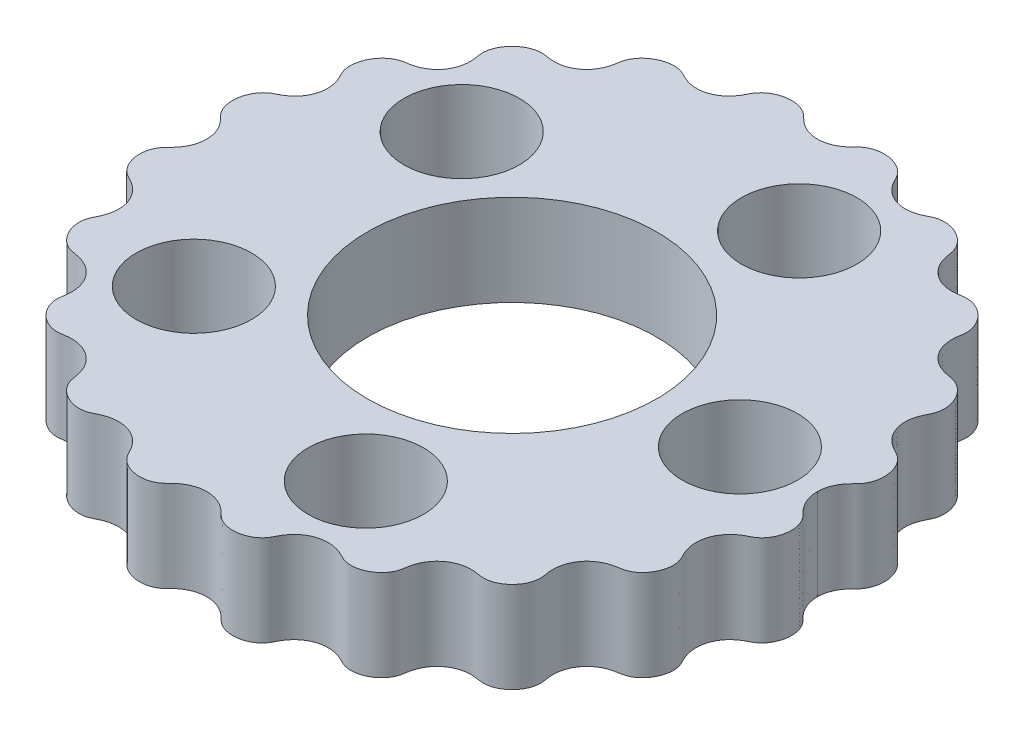
from build123d import *

# Parameters (mm, degrees)
BOSS_EXTRUDE1_START = 1
MAIN_R              = 3.8
MAIN_R_2            = 9.525
BOSS_EXTRUDE1_DEPTH = 6


with BuildPart() as part:
    # MAIN → Boss-Extrude1 (new body)
    with BuildSketch(Plane(origin=(0, 0, 0), x_dir=(1, 0, 0), z_dir=(0, 1, 0)).offset(BOSS_EXTRUDE1_START)):
        with BuildLine():
            add(Edge.make_bspline(
                [(20.1, 0), (20.1, 0.016049474), (20.10042819, 0.048265255), (20.102997256, 0.122217827), (20.111980932, 0.241772144), (20.129908594, 0.365784261), (20.160482731, 0.510263145), (20.200949467, 0.651927408), (20.251052975, 0.790295326), (20.310457626, 0.925031815), (20.405026773, 1.105489785), (20.522557341, 1.284294211), (20.663651728, 1.457905797), (20.825054173, 1.626232115), (20.958535869, 1.756480173), (21.084001151, 1.894913118), (21.19070215, 2.048527229), (21.322181138, 2.295585844), (21.436381782, 2.652555263), (21.480312105, 3.117719001), (21.403906438, 3.600484736), (21.255410516, 3.988503115), (21.088113178, 4.266212931), (20.940586592, 4.45153473), (20.783892784, 4.60313609), (20.624163597, 4.722840948), (20.449787935, 4.819202), (20.27144251, 4.907182077), (20.053826972, 5.02775347), (19.772663447, 5.220092779), (19.460268988, 5.522133789), (19.170367617, 5.979141351), (19.000054809, 6.550986456), (18.996788488, 7.09347867), (19.100354653, 7.522100535), (19.22600522, 7.825047936), (19.323069978, 8.019726709), (19.403208808, 8.17418946), (19.489181816, 8.374410265), (19.566475444, 8.682529861), (19.577864851, 9.101072271), (19.464679992, 9.610899865), (19.231249329, 10.06169528), (18.951631481, 10.396325325), (18.687316384, 10.612198661), (18.478605363, 10.738828373), (18.27672622, 10.826592284), (18.088022057, 10.880549413), (17.894642882, 10.91173651), (17.701344091, 10.941923543), (17.509848243, 10.983109484), (17.321856927, 11.038173185), (17.054914968, 11.140977964), (16.724922472, 11.324678262), (16.36394906, 11.636125273), (16.04411147, 12.112470544), (15.877508027, 12.614075001), (15.840960492, 13.04599222), (15.865791708, 13.378406904), (15.901121962, 13.611045435), (15.931904955, 13.796812252), (15.948155089, 14.03214825), (15.914834064, 14.353727504), (15.78710039, 14.744710058), (15.520698222, 15.177621098), (15.172973033, 15.516306183), (14.815895064, 15.740926601), (14.502994467, 15.864191931), (14.267579789, 15.921315139), (14.048828919, 15.944131552), (13.851076664, 15.938715819), (13.655902731, 15.909039398), (13.461304909, 15.877385295), (13.264984922, 15.856779828), (13.067674425, 15.850574212), (12.776173172, 15.865678978), (12.395590433, 15.940956671), (11.938569212, 16.137109085), (11.470553416, 16.519893429), (11.162879572, 16.97049216), (11.008945031, 17.382763009), (10.941723246, 17.700684498), (10.909391818, 17.910609622), (10.88131532, 18.078311006), (10.825896286, 18.28384026), (10.700795847, 18.566487319), (10.463238575, 18.896536387), (10.10649369, 19.20329467), (9.672270844, 19.42958383), (9.232677179, 19.551096678), (8.86266136, 19.576275628), (8.573868633, 19.540840142), (8.371319786, 19.482977256), (8.233500913, 19.429263516), (8.108846995, 19.36980218), (7.971859121, 19.298414607), (7.817815897, 19.224247184), (7.620319341, 19.142348296), (7.375175899, 19.065537121), (7.059284278, 19.008648031), (6.674311347, 19.005623312), (6.23487299, 19.085333044), (5.767240847, 19.286472452), (5.38043875, 19.585271088), (5.114615337, 19.91251743), (4.953608216, 20.183713005), (4.838337688, 20.408845665), (4.72360429, 20.635366187), (4.500791609, 20.915757491), (4.133761058, 21.194811415), (3.650572556, 21.401524152), (3.141425397, 21.474182478), (2.701085807, 21.439094531), (2.367723237, 21.345707693), (2.140403794, 21.245160735), (1.970791827, 21.139493932), (1.852684175, 21.04557956), (1.760619588, 20.960149721), (1.689220401, 20.8894654), (1.618180579, 20.81844632), (1.5460278, 20.748562596), (1.453458035, 20.663707945), (1.33785031, 20.566946935), (1.195706387, 20.46317673), (0.944410243, 20.311151454), (0.586883972, 20.160779511), (0.097411097, 20.067712928), (-0.506706748, 20.123705295), (-1.010623007, 20.324911261), (-1.364703608, 20.576832472), (-1.593509044, 20.792533664), (-1.731815119, 20.932868041), (-1.846227845, 21.041471908), (-2.001916865, 21.162825929), (-2.254686782, 21.308029569), (-2.62139071, 21.431603659), (-3.111950077, 21.479440319), (-3.664222652, 21.395690883), (-4.133751672, 21.194811679), (-4.50079738, 20.915757334), (-4.723600954, 20.635366277), (-4.838339701, 20.408845611), (-4.95360724, 20.183713031), (-5.114615975, 19.912517413), (-5.380438356, 19.585271099), (-5.767241074, 19.286472446), (-6.23487286, 19.085333048), (-6.674311426, 19.00562331), (-7.059284219, 19.008648033), (-7.37517594, 19.06553712), (-7.620319317, 19.142348297), (-7.817815908, 19.224247184), (-7.971859116, 19.298414607), (-8.108846996, 19.36980218), (-8.233500913, 19.429263515), (-8.371319785, 19.482977259), (-8.573868636, 19.540840136), (-8.862661354, 19.57627564), (-9.232677188, 19.551096661), (-9.672270832, 19.429583855), (-10.106493713, 19.203294623), (-10.463238537, 18.896536464), (-10.7007959, 18.566487209), (-10.825896203, 18.283840429), (-10.881315502, 18.078310633), (-10.909391314, 17.910610649), (-10.941724273, 17.700682406), (-11.008943, 17.382767148), (-11.162882957, 16.970485259), (-11.470548885, 16.519902665), (-11.938575656, 16.137095951), (-12.441451846, 15.92129044), (-12.874268252, 15.849349026), (-13.215931604, 15.851574086), (-13.461292159, 15.877411282), (-13.65590942, 15.909025764), (-13.851073848, 15.938721557), (-14.048830186, 15.944128969), (-14.267579135, 15.921316472), (-14.502994784, 15.864191285), (-14.815894857, 15.740927023), (-15.172973177, 15.516305889), (-15.520698126, 15.177621293), (-15.787100449, 14.744709937), (-15.914834028, 14.353727576), (-15.948155108, 14.032148211), (-15.931904943, 13.796812277), (-15.901121967, 13.611045423), (-15.865791705, 13.37840691), (-15.840960494, 13.045992217), (-15.877508026, 12.614075003), (-16.044111471, 12.112470543), (-16.363949059, 11.636125274), (-16.724922472, 11.324678262), (-17.054914968, 11.140977965), (-17.321856927, 11.038173185), (-17.509848243, 10.983109484), (-17.701344091, 10.941923543), (-17.894642882, 10.911736511), (-18.088022057, 10.880549413), (-18.27672622, 10.826592284), (-18.478605363, 10.738828373), (-18.687316384, 10.612198661), (-18.951631481, 10.396325326), (-19.231249329, 10.06169528), (-19.464679992, 9.610899865), (-19.577864851, 9.101072271), (-19.566475444, 8.682529861), (-19.489181816, 8.374410265), (-19.403208808, 8.17418946), (-19.323069978, 8.01972671), (-19.22600522, 7.825047936), (-19.100354653, 7.522100535), (-18.996788488, 7.093478671), (-19.000054809, 6.550986456), (-19.170367616, 5.979141351), (-19.460268988, 5.52213379), (-19.772663447, 5.220092779), (-20.053826972, 5.027753471), (-20.27144251, 4.907182077), (-20.449787935, 4.819202), (-20.624163597, 4.722840949), (-20.783892784, 4.60313609), (-20.940586592, 4.45153473), (-21.088113178, 4.266212931), (-21.255410516, 3.988503115), (-21.403906438, 3.600484737), (-21.480312105, 3.117719001), (-21.436381782, 2.652555264), (-21.322181138, 2.295585843), (-21.19070215, 2.048527232), (-21.084001151, 1.894913113), (-20.958535869, 1.756480188), (-20.825054173, 1.626232085), (-20.663651728, 1.45790587), (-20.522557341, 1.284294066), (-20.405026773, 1.105490041), (-20.310457626, 0.9250314), (-20.251052975, 0.790296167), (-20.200949467, 0.651926266), (-20.16048273, 0.510264245), (-20.129908594, 0.365772489), (-20.111980932, 0.24187695), (-20.102997255, 0.121794435), (-20.100428187, 0.048465762), (-20.1, 0.016049475), (-20.1, -0.02171016), (-20.100740365, -0.065537224), (-20.104071934, -0.144156063), (-20.112945474, -0.24888272), (-20.129548599, -0.371521199), (-20.158221265, -0.515938033), (-20.204239041, -0.684918351), (-20.273520329, -0.870557648), (-20.358752691, -1.050317426), (-20.458985655, -1.221772432), (-20.566593118, -1.375373307), (-20.677800781, -1.512107496), (-20.78907177, -1.633996227), (-20.89729475, -1.743281226), (-21.006487753, -1.851660443), (-21.108826998, -1.966746908), (-21.220223107, -2.123936398), (-21.346640876, -2.369339666), (-21.448804421, -2.714922855), (-21.479569019, -3.150863822), (-21.406738099, -3.6189376), (-21.253503208, -4.010050586), (-21.054801466, -4.3167693), (-20.834568393, -4.54681101), (-20.612263971, -4.704344178), (-20.325273755, -4.839756744), (-20.00852218, -5.01868956), (-19.684333315, -5.273417476), (-19.386374063, -5.622567486), (-19.165380649, -6.023790243), (-19.031235387, -6.460667693), (-18.988554194, -6.914383703), (-19.031153524, -7.309949886), (-19.121535833, -7.637383735), (-19.231185759, -7.907699698), (-19.340003931, -8.125599511), (-19.458279678, -8.349696035), (-19.534342307, -8.60201151), (-19.571226544, -8.910170929), (-19.547468686, -9.268289446), (-19.441274763, -9.663411072), (-19.230677135, -10.071117867), (-18.962617101, -10.393930449), (-18.69456545, -10.607356203), (-18.463252178, -10.732656246), (-18.290990166, -10.798741664), (-18.148391024, -10.836569426), (-18.003178925, -10.861951575), (-17.857558256, -10.884265091), (-17.641121776, -10.923327988), (-17.357371949, -10.996845119), (-17.017888737, -11.137017594), (-16.649928165, -11.379284126), (-16.334369672, -11.690450594), (-16.08502107, -12.060144405), (-15.913420845, -12.474413535), (-15.837321702, -12.861692439), (-15.826145974, -13.198469455), (-15.849040745, -13.486913028), (-15.886691352, -13.72544992), (-15.927162315, -13.973460833), (-15.917763897, -14.234537693), (-15.855442161, -14.535749675), (-15.720933739, -14.865237104), (-15.494128005, -15.210409224), (-15.157431132, -15.538376323), (-14.781408984, -15.76822783), (-14.431758379, -15.886583939), (-14.146771031, -15.923570894), (-13.940431266, -15.917988379), (-13.777045476, -15.895710114), (-13.573931264, -15.861918407), (-13.311432759, -15.830171544), (-12.987810263, -15.826054921), (-12.60914423, -15.881308187), (-12.229522049, -16.007230154), (-11.876954427, -16.1993096), (-11.563437142, -16.452525279), (-11.299633908, -16.759177641), (-11.094221009, -17.109263485), (-10.975435401, -17.427961134), (-10.912460643, -17.694217159), (-10.877730043, -17.89918615), (-10.856064449, -18.0401656), (-10.822771699, -18.215436473), (-10.756071908, -18.419634752), (-10.618321052, -18.683058453), (-10.378992613, -18.978083153), (-10.050155805, -19.245203321), (-9.632890947, -19.453548744), (-9.223494552, -19.555845862), (-8.883602633, -19.569595951), (-8.624829389, -19.53453372), (-8.448145167, -19.486752645), (-8.311702249, -19.433795975), (-8.180359463, -19.369482763), (-8.050463002, -19.302491925), (-7.848916598, -19.205079035), (-7.567592994, -19.094767002), (-7.195942419, -19.007772682), (-6.736051918, -18.99379513), (-6.286118287, -19.073202806), (-5.86481401, -19.240976426), (-5.488630496, -19.487915279), (-5.210069989, -19.761933205), (-5.011673366, -20.030377918), (-4.88402849, -20.249288085), (-4.804678509, -20.403650404), (-4.722737461, -20.564714017), (-4.627134448, -20.726897435), (-4.486551992, -20.896721045), (-4.26137917, -21.094571853), (-3.962456049, -21.275011587), (-3.592508535, -21.411382192), (-3.15817733, -21.475362584), (-2.768745757, -21.452327592), (-2.437761406, -21.369500955), (-2.168271589, -21.248422688), (-1.958055932, -21.110173628), (-1.785447744, -20.94091701), (-1.622730612, -20.775668556), (-1.414624707, -20.592569598), (-1.152020167, -20.405823234), (-0.814799819, -20.236460165), (-0.395794796, -20.11756634), (0.04306138, -20.082050137), (0.484607542, -20.134421982), (0.91116178, -20.274957645), (1.271012064, -20.478453824), (1.534676394, -20.691199523), (1.722859475, -20.876678362), (1.857461379, -21.012098347), (1.972236287, -21.113107357), (2.128810544, -21.222996315), (2.369691528, -21.346150999), (2.705938739, -21.446074355), (3.128997453, -21.478869711), (3.583297764, -21.414776575), (3.962473712, -21.275005607), (4.261368893, -21.094575333), (4.486558386, -20.89671888), (4.627130565, -20.726898749), (4.722739327, -20.564713386), (4.804677846, -20.403650629), (4.884028711, -20.249288011), (5.011673252, -20.030377957), (5.210070055, -19.761933183), (5.488630456, -19.487915292), (5.864814032, -19.240976419), (6.286118273, -19.073202811), (6.736051926, -18.993795127), (7.195942412, -19.007772684), (7.567592997, -19.094767), (7.848916597, -19.205079036), (8.050463002, -19.302491925), (8.180359447, -19.369482757), (8.311702337, -19.433796008), (8.448144957, -19.486752569), (8.624829844, -19.534533887), (8.883601698, -19.569595609), (9.22349619, -19.555846462), (9.632888472, -19.453547838), (10.050159599, -19.245204711), (10.378986666, -18.978080976), (10.61833073, -18.683061996), (10.756055979, -18.419628921), (10.822802865, -18.215447882), (10.862648263, -18.005084067), (10.897177746, -17.764021208), (10.9630027, -17.461561655), (11.094176446, -17.109247173), (11.299658013, -16.759186465), (11.563423205, -16.452520178), (11.876963914, -16.199313073), (12.229515738, -16.007227845), (12.609148784, -15.881309854), (12.987807102, -15.826053764), (13.311434593, -15.830172215), (13.57393037, -15.861918081), (13.777045847, -15.895710251), (13.940431152, -15.917988338), (14.14677108, -15.923570912), (14.431758349, -15.886583928), (14.781409003, -15.768227837), (15.15743112, -15.53837632), (15.494128012, -15.210409227), (15.720933734, -14.865237102), (15.855442163, -14.535749676), (15.917763895, -14.234537693), (15.927162316, -13.973460834), (15.886691351, -13.72544992), (15.849040745, -13.486913028), (15.826145973, -13.198469455), (15.837321702, -12.861692439), (15.913420844, -12.474413536), (16.085021069, -12.060144406), (16.334369672, -11.690450595), (16.649928164, -11.379284126), (17.017888736, -11.137017594), (17.357371949, -10.99684512), (17.641121776, -10.923327988), (17.857558256, -10.884265091), (18.003178929, -10.86195157), (18.148391004, -10.836569454), (18.290990211, -10.798741599), (18.463252081, -10.732656387), (18.694565648, -10.607355915), (18.96261675, -10.393930958), (19.23067766, -10.071117106), (19.441273966, -9.663412226), (19.54746991, -9.268287674), (19.571224635, -8.910173694), (19.534345549, -8.602006815), (19.458272769, -8.34970604), (19.340018236, -8.125578794), (19.231160509, -7.907736265), (19.14282673, -7.689724945), (19.076304167, -7.473725478), (19.019020301, -7.196875925), (18.993846489, -6.857849588), (19.031255544, -6.460638503), (19.165368749, -6.023807477), (19.386381461, -5.622556771), (19.684328371, -5.273424636), (20.008525148, -5.018685262), (20.325272171, -4.839759039), (20.612264677, -4.704343157), (20.834568029, -4.546811538), (21.054801685, -4.316768984), (21.253503069, -4.010050789), (21.40673819, -3.618937469), (21.479568958, -3.150863911), (21.448804463, -2.714922796), (21.346640853, -2.3693397), (21.220223118, -2.123936381), (21.108826992, -1.966746916), (21.006487755, -1.85166044), (20.897294749, -1.743281222), (20.78907177, -1.633996261), (20.677800781, -1.512107366), (20.566593118, -1.375373687), (20.458985655, -1.221771519), (20.358752691, -1.050319311), (20.273520329, -0.870553985), (20.204239041, -0.684923618), (20.158221265, -0.5159414), (20.129548599, -0.371490762), (20.112945473, -0.248940239), (20.104071929, -0.144509512), (20.100740368, -0.065175164), (20.1, -0.021710161), (20.1, 0)],
                knots=[0.063609002, 0.063609002, 0.063609002, 0.063609002, 0.063609002, 0.064458074, 0.065307146, 0.06700529, 0.068703435, 0.070401579, 0.072099723, 0.073797867, 0.075496012, 0.077194156, 0.081499833, 0.083652672, 0.085805511, 0.087958349, 0.090111188, 0.092264027, 0.094416865, 0.100851345, 0.107285824, 0.113598849, 0.116755361, 0.119911874, 0.122207841, 0.124503809, 0.126799776, 0.129095744, 0.131391711, 0.133687679, 0.138279613, 0.144786754, 0.151293894, 0.158381972, 0.16547005, 0.169487075, 0.171495587, 0.1735041, 0.175512612, 0.177521124, 0.181538149, 0.188088893, 0.194639636, 0.201358698, 0.204718229, 0.20807776, 0.210336636, 0.212595511, 0.214854386, 0.217113262, 0.219372137, 0.221631013, 0.223889888, 0.226148764, 0.232563486, 0.238978207, 0.245649795, 0.252321382, 0.256667064, 0.258839905, 0.261012746, 0.263185587, 0.265358428, 0.269704109, 0.275848778, 0.281993447, 0.288591296, 0.291890221, 0.295189145, 0.297465562, 0.29974198, 0.302018397, 0.304294814, 0.306571231, 0.308847648, 0.311124065, 0.313400483, 0.320031256, 0.32666203, 0.333803829, 0.340945629, 0.344868761, 0.346830327, 0.348791893, 0.350753459, 0.352715025, 0.356638156, 0.362992656, 0.369347155, 0.374206536, 0.379065918, 0.383918614, 0.386344962, 0.387558136, 0.38877131, 0.390744311, 0.392717312, 0.394690313, 0.396663314, 0.400609317, 0.404555319, 0.409450074, 0.414344829, 0.421090178, 0.427835527, 0.431732176, 0.433680501, 0.435628826, 0.439525475, 0.443422124, 0.450061542, 0.456700961, 0.46350218, 0.46690279, 0.4703034, 0.472622355, 0.47494131, 0.476100788, 0.477260265, 0.478419743, 0.479579221, 0.480738698, 0.481898176, 0.484217131, 0.486536087, 0.488855042, 0.495440463, 0.502025885, 0.509259804, 0.516493724, 0.520132717, 0.521952213, 0.523771709, 0.525591206, 0.527410702, 0.531049695, 0.537174367, 0.543299039, 0.549938458, 0.556577876, 0.560474525, 0.564371174, 0.566319499, 0.568267824, 0.572164473, 0.578909822, 0.585655171, 0.590549926, 0.595444681, 0.599390683, 0.603336686, 0.605309687, 0.607282688, 0.609255689, 0.61122869, 0.612441864, 0.613655038, 0.616081386, 0.620934082, 0.625793464, 0.630652845, 0.637007344, 0.643361844, 0.647284975, 0.649246541, 0.651208107, 0.653169673, 0.655131239, 0.659054371, 0.666196171, 0.67333797, 0.679968744, 0.686599517, 0.691152352, 0.693428769, 0.695705186, 0.697981603, 0.70025802, 0.702534438, 0.704810855, 0.708109779, 0.711408704, 0.718006553, 0.724151222, 0.730295891, 0.734641572, 0.736814413, 0.738987254, 0.741160095, 0.743332936, 0.747678618, 0.754350205, 0.761021793, 0.767436514, 0.773851236, 0.776110112, 0.778368987, 0.780627863, 0.782886738, 0.785145614, 0.787404489, 0.789663364, 0.79192224, 0.795281771, 0.798641302, 0.805360364, 0.811911107, 0.818461851, 0.822478876, 0.824487388, 0.8264959, 0.828504413, 0.830512925, 0.83452995, 0.841618028, 0.848706106, 0.855213246, 0.861720387, 0.866312321, 0.868608289, 0.870904256, 0.873200224, 0.875496191, 0.877792159, 0.880088126, 0.883244639, 0.886401151, 0.892714176, 0.899148655, 0.905583135, 0.907735973, 0.909888812, 0.912041651, 0.914194489, 0.916347328, 0.918500167, 0.922805844, 0.924503988, 0.926202133, 0.927900277, 0.929598421, 0.931296565, 0.93299471, 0.934692854, 0.935541926, 0.936390998, 0.936390998, 0.936390998, 0.93753954, 0.938688082, 0.939836624, 0.940985165, 0.943282249, 0.945579333, 0.947876416, 0.9501735, 0.952470583, 0.954767667, 0.956547976, 0.958328284, 0.960108593, 0.961888902, 0.96366921, 0.965449519, 0.969010136, 0.974615965, 0.980221794, 0.985496461, 0.990771127, 0.993903217, 0.997035308, 1.000167399, 1.00329949, 1.008576822, 1.013854154, 1.019131487, 1.024408819, 1.029635531, 1.034862243, 1.040088955, 1.042702312, 1.045315668, 1.048344949, 1.05137423, 1.054403511, 1.057432793, 1.06265791, 1.067883028, 1.073200187, 1.078517346, 1.081927608, 1.083632739, 1.08533787, 1.087043002, 1.088748133, 1.090453264, 1.092158395, 1.097225308, 1.102292221, 1.107359134, 1.112426048, 1.117611695, 1.122797343, 1.127982991, 1.130575815, 1.133168639, 1.136171384, 1.139174129, 1.142176874, 1.145179619, 1.150361937, 1.155544256, 1.161155886, 1.166767516, 1.170581224, 1.172488079, 1.174394933, 1.176301787, 1.178208641, 1.18202235, 1.186627433, 1.191232516, 1.195837599, 1.200442682, 1.205116059, 1.209789435, 1.214462812, 1.219136189, 1.220786941, 1.222437693, 1.224088444, 1.225739196, 1.2290407, 1.232342203, 1.237773978, 1.243205753, 1.24848755, 1.253769348, 1.2571526, 1.258844225, 1.260535851, 1.262227477, 1.263919103, 1.265610729, 1.267302354, 1.272591297, 1.27788024, 1.283169183, 1.288458126, 1.293594209, 1.298730291, 1.303866374, 1.306434415, 1.309002456, 1.310452146, 1.311901836, 1.314801216, 1.317700595, 1.320599975, 1.325733449, 1.330866922, 1.335823509, 1.340780095, 1.343673181, 1.346566267, 1.349459352, 1.352352438, 1.354832904, 1.357313371, 1.362274305, 1.367235238, 1.372196172, 1.377359301, 1.382522431, 1.387685561, 1.39284869, 1.396383657, 1.39815114, 1.399918623, 1.401686106, 1.403453589, 1.406988556, 1.412394883, 1.41780121, 1.422934684, 1.428068158, 1.430967537, 1.433866917, 1.436766297, 1.438215987, 1.439665676, 1.442233718, 1.444801759, 1.449937841, 1.455073924, 1.460210007, 1.465498949, 1.470787892, 1.476076835, 1.481365778, 1.483057404, 1.48474903, 1.486440656, 1.488132281, 1.489823907, 1.491515533, 1.494898785, 1.500180582, 1.50546238, 1.510894155, 1.516325929, 1.519627433, 1.522928937, 1.524579688, 1.52623044, 1.529531944, 1.53420532, 1.538878697, 1.543552074, 1.548225451, 1.552830534, 1.557435617, 1.5620407, 1.566645783, 1.570459491, 1.572366345, 1.5742732, 1.576180054, 1.578086908, 1.581900617, 1.587512247, 1.593123877, 1.598306195, 1.603488514, 1.606491259, 1.609494004, 1.612496749, 1.615499494, 1.618092318, 1.620685142, 1.625870789, 1.631056437, 1.636242085, 1.641308998, 1.646375911, 1.651442825, 1.656509738, 1.658214869, 1.65992, 1.661625131, 1.663330262, 1.665035393, 1.666740524, 1.670150786, 1.675467945, 1.680785105, 1.686010222, 1.69123534, 1.694264621, 1.697293903, 1.700323184, 1.703352465, 1.705965821, 1.708579177, 1.711192533, 1.713805889, 1.719032601, 1.724259314, 1.729536646, 1.734813978, 1.740091311, 1.745368643, 1.748500734, 1.751632824, 1.754764915, 1.757897006, 1.763171672, 1.768446338, 1.774052167, 1.779657997, 1.783218614, 1.784998922, 1.786779231, 1.78855954, 1.790339848, 1.792120157, 1.793900466, 1.796197549, 1.798494633, 1.800791716, 1.8030888, 1.805385884, 1.807682967, 1.808831509, 1.809980051, 1.811128593, 1.812277134, 1.812277134, 1.812277134, 1.812277134, 1.812277134], degree=4))
        make_face()
        with Locations((15, 0)):
            Circle(MAIN_R, mode=Mode.SUBTRACT)
        with Locations((4.635254916, -14.265847744)):
            Circle(MAIN_R, mode=Mode.SUBTRACT)
        with Locations((-12.135254916, -8.816778784)):
            Circle(MAIN_R, mode=Mode.SUBTRACT)
        with Locations((-12.135254916, 8.816778784)):
            Circle(MAIN_R, mode=Mode.SUBTRACT)
        with Locations((4.635254916, 14.265847744)):
            Circle(MAIN_R, mode=Mode.SUBTRACT)
        Circle(MAIN_R_2, mode=Mode.SUBTRACT)
    extrude(amount=BOSS_EXTRUDE1_DEPTH)


solid = part.part
